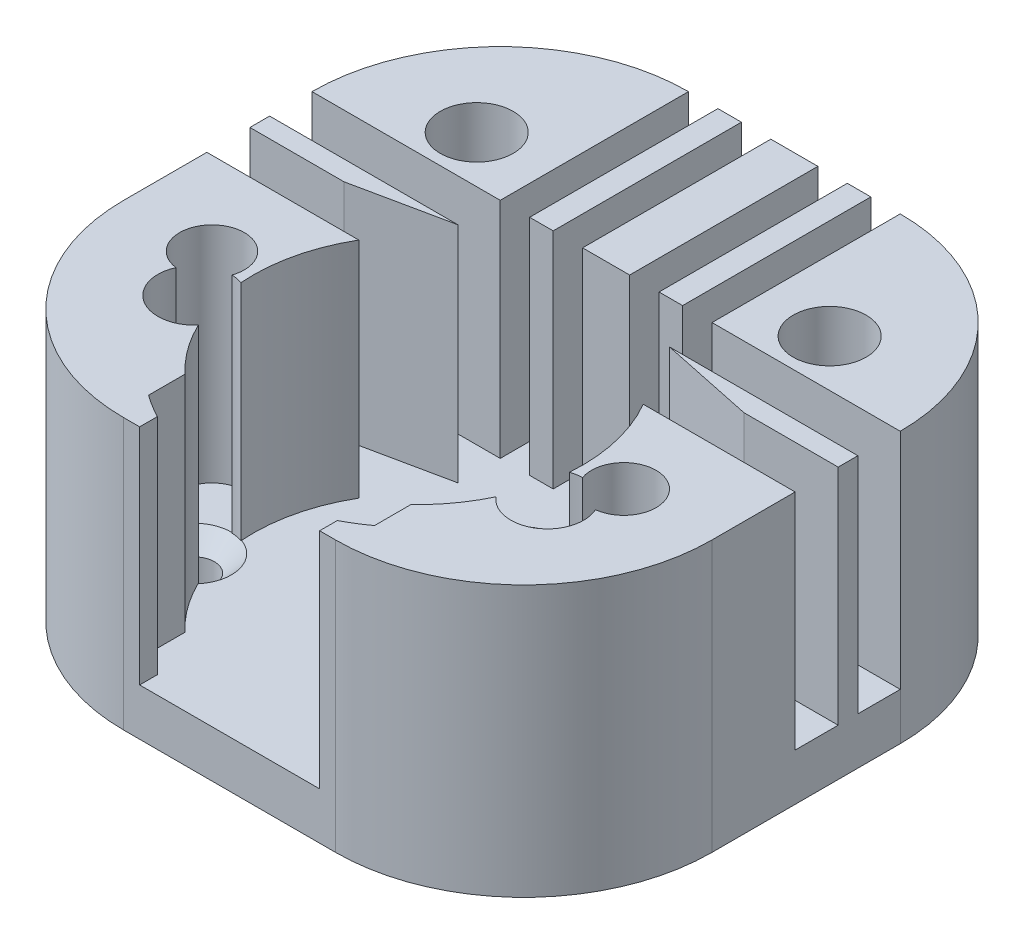
from build123d import *

# Parameters (mm, degrees)
SKETCH1_R                                    = 1.650000221024274
BOSS_EXTRUDE1_DEPTH                          = 4
BOSS_EXTRUDE2_OUTLINE_R                      = 2.75
BOSS_EXTRUDE2_OUTLINE_R_2                    = 1.650000221
BOSS_EXTRUDE2_OUTLINE_W                      = 2.000000000000001
BOSS_EXTRUDE2_OUTLINE_H                      = 16.000000209
BOSS_EXTRUDE2_OUTLINE_W_2                    = 4
BOSS_EXTRUDE2_DEPTH                          = 19
SKETCH6_R                                    = 3.1000000000000005
SKETCH6_R_2                                  = 3.0999999999999988
CUT_EXTRUDE2_DEPTH                           = 17
SKETCH7_R                                    = 3.1000000000000005
SKETCH7_R_2                                  = 3.0999999999999988
CUT_EXTRUDE3_DEPTH                           = 2
SKETCH11_R                                   = 5
CUT_EXTRUDE4_DEPTH                           = 10
CSK_FOR_M3_CROSS_RECESS_FLAT_HEAD_SC_2_COUNT = 2
CSK_FOR_M3_CROSS_RECESS_FLAT_HEAD_SC_2_PITCH = 29.999999886192118


# Read off the part's stored shape, not the designer's step: Boss-Extrude2
with BuildPart() as part:
    # Sketch1 → Boss-Extrude1 (new body)
    with BuildSketch(Plane(origin=(0, 0, 0), x_dir=(1, 0, 0), z_dir=(0, 1, 0))):
        with BuildLine():
            Line((-9.000000372528914, 24.000000208616257), (9.000000372528918, 24.000000208616257))
            ThreePointArc((9.000000372528918, 24.000000208616257), (20.31370887151379, 19.313708707601016), (25.00000037252903, 8.000000208616145))
            Line((25.00000037252903, 8.000000208616145), (25.00000037252903, -8.000000208616145))
            ThreePointArc((25.00000037252903, -8.000000208616145), (20.31370887151379, -19.313708707601016), (9.000000372528918, -24.000000208616257))
            Line((9.000000372528918, -24.000000208616257), (-9.000000372528914, -24.000000208616257))
            ThreePointArc((-9.000000372528914, -24.000000208616257), (-20.313708871513793, -19.31370870760102), (-25.00000037252903, -8.000000208616145))
            Line((-25.00000037252903, -8.000000208616145), (-25.00000037252903, 8.000000208616145))
            ThreePointArc((-25.00000037252903, 8.000000208616145), (-20.31370887151379, 19.313708707601016), (-9.000000372528914, 24.000000208616257))
        make_face()
        with Locations(Location((-14.999999943096059, 12.000001695688482, 0), (0, 0, 270))):
            Circle(SKETCH1_R, mode=Mode.SUBTRACT)
        with Locations(Location((14.999999943096059, 12.00000169568849, 0), (0, 0, 90))):
            Circle(SKETCH1_R, mode=Mode.SUBTRACT)
        with Locations(Location((14.999999943096059, -12.00000169568849, 0), (0, 0, 270))):
            Circle(SKETCH1_R, mode=Mode.SUBTRACT)
        with Locations(Location((-14.999999943096059, -12.000001695688482, 0), (0, 0, 90))):
            Circle(SKETCH1_R, mode=Mode.SUBTRACT)
    extrude(amount=BOSS_EXTRUDE1_DEPTH)

    # Boss-Extrude2 outline → Boss-Extrude2 (add)
    # profile 1 of 9: a face of its own
    with BuildSketch(Plane(origin=(0, 4, 0), x_dir=(1, 0, 0), z_dir=(0, 1, 0))):
        with BuildLine():
            ThreePointArc((-25.000000373, -8.000000209), (-20.313708872, -19.313708708), (-9.000000373, -24.000000209))
            Line((-9.000000373, -24.000000209), (-7.65, -24.000000209))
            Line((-7.65, -24.000000209), (-7.65, -22.5))
            ThreePointArc((-7.65, -22.5), (-8.646208076, -21.928947768), (-9.6, -21.289563574))
            Line((-9.6, -21.289563574), (-9.6, -18.190191362))
            ThreePointArc((-9.6, -18.190191362), (-11.86645746, -15.428807936), (-13.360259128, -12.183715576))
            ThreePointArc((-13.360259128, -12.183715576), (-16.594287762, -12.425145296), (-13.669460049, -11.024212621))
            ThreePointArc((-13.669460049, -11.024212621), (-13.83087583, -5.830466926), (-12.086943849, -0.935597096))
            Line((-12.086943849, -0.935597096), (-25.000000373, -0.935597096))
            Line((-25.000000373, -0.935597096), (-25.000000373, -8.000000209))
        make_face()
        with Locations((-17.5, -8)):
            Circle(BOSS_EXTRUDE2_OUTLINE_R, mode=Mode.SUBTRACT)
    # profile 2 of 9: a face of its own
    with BuildSketch(Plane(origin=(0, 4, 0), x_dir=(1, 0, 0), z_dir=(0, 1, 0))):
        with BuildLine():
            Line((7.65, -22.5), (7.65, -24.000000209))
            Line((7.65, -24.000000209), (9.000000373, -24.000000209))
            ThreePointArc((9.000000373, -24.000000209), (20.313708872, -19.313708708), (25.000000373, -8.000000209))
            Line((25.000000373, -8.000000209), (25.000000373, -0.935597096))
            Line((25.000000373, -0.935597096), (12.086943849, -0.935597096))
            ThreePointArc((12.086943849, -0.935597096), (13.83087583, -5.830466926), (13.669460049, -11.024212621))
            ThreePointArc((13.669460049, -11.024212621), (16.594287762, -12.425145296), (13.360259128, -12.183715576))
            ThreePointArc((13.360259128, -12.183715576), (11.86645746, -15.428807936), (9.6, -18.190191362))
            Line((9.6, -18.190191362), (9.6, -21.289563574))
            ThreePointArc((9.6, -21.289563574), (8.646208076, -21.928947768), (7.65, -22.5))
        make_face()
        with Locations((17.5, -8)):
            Circle(BOSS_EXTRUDE2_OUTLINE_R, mode=Mode.SUBTRACT)
    # profile 3 of 9: a face of its own
    with BuildSketch(Plane(origin=(0, 4, 0), x_dir=(1, 0, 0), z_dir=(0, 1, 0))):
        Polygon((-25.000000373, 4.399596768), (-25.000000373, 2.723805295), (-17, 2.723805295), (-9, 4.399596768), align=None)
    # profile 4 of 9: a face of its own
    with BuildSketch(Plane(origin=(0, 4, 0), x_dir=(1, 0, 0), z_dir=(0, 1, 0))):
        with BuildLine():
            ThreePointArc((-9.000000373, 24.000000209), (-20.313708872, 19.313708708), (-25.000000373, 8.000000209))
            Line((-25.000000373, 8.000000209), (-9, 8))
            Line((-9, 8), (-9.000000373, 24.000000209))
        make_face()
        with Locations((-14.999999943, 12.000001696)):
            Circle(BOSS_EXTRUDE2_OUTLINE_R_2, mode=Mode.SUBTRACT)
    # profile 5 of 9: a face of its own
    with BuildSketch(Plane(origin=(0, 4, 0), x_dir=(1, 0, 0), z_dir=(0, 1, 0))):
        Polygon((17, 2.723805295), (25.000000373, 2.723805295), (25.000000373, 4.399596768), (9, 4.399596768), align=None)
    # profile 6 of 9: a face of its own
    with BuildSketch(Plane(origin=(0, 4, 0), x_dir=(1, 0, 0), z_dir=(0, 1, 0))):
        with Locations((-5.5, 16.0000001045)):
            Rectangle(BOSS_EXTRUDE2_OUTLINE_W, BOSS_EXTRUDE2_OUTLINE_H)
    # profile 7 of 9: a face of its own
    with BuildSketch(Plane(origin=(0, 4, 0), x_dir=(1, 0, 0), z_dir=(0, 1, 0))):
        with BuildLine():
            Line((9, 8), (25.000000373, 8.000000209))
            ThreePointArc((25.000000373, 8.000000209), (20.313708872, 19.313708708), (9.000000373, 24.000000209))
            Line((9.000000373, 24.000000209), (9, 8))
        make_face()
        with Locations((14.999999943, 12.000001696)):
            Circle(BOSS_EXTRUDE2_OUTLINE_R_2, mode=Mode.SUBTRACT)
    # profile 8 of 9: a face of its own
    with BuildSketch(Plane(origin=(0, 4, 0), x_dir=(1, 0, 0), z_dir=(0, 1, 0))):
        with Locations((0, 16.0000001045)):
            Rectangle(BOSS_EXTRUDE2_OUTLINE_W_2, BOSS_EXTRUDE2_OUTLINE_H)
    # profile 9 of 9: a face of its own
    with BuildSketch(Plane(origin=(0, 4, 0), x_dir=(1, 0, 0), z_dir=(0, 1, 0))):
        with Locations((5.5, 16.0000001045)):
            Rectangle(BOSS_EXTRUDE2_OUTLINE_W, BOSS_EXTRUDE2_OUTLINE_H)
    extrude(amount=BOSS_EXTRUDE2_DEPTH)

    # Sketch6 → Cut-Extrude2 (cut)
    with BuildSketch(Plane(origin=(0, 23, 0), x_dir=(1, 0, 0), z_dir=(0, 1, 0))):
        with Locations((-14.999999943096059, -12.000001695688482)):
            Circle(SKETCH6_R)
        with Locations((14.999999943096062, -12.000001695688479)):
            Circle(SKETCH6_R_2)
        with Locations(Location((14.999999943096059, 12.000001695688482, 0), (0, 0, 270))):
            Circle(SKETCH6_R_2)
        with Locations(Location((-14.999999943096062, 12.000001695688479, 0), (0, 0, 90))):
            Circle(SKETCH6_R)
    extrude(amount=-CUT_EXTRUDE2_DEPTH, mode=Mode.SUBTRACT)

    # Sketch7 → Cut-Extrude3 (cut)
    with BuildSketch(Plane(origin=(0, 5.999999999999998, 0), x_dir=(1, 0, 0), z_dir=(0, 1, 0))):
        with Locations((-14.999999943096059, -12.000001695688482)):
            Circle(SKETCH7_R)
        with Locations((14.999999943096062, -12.000001695688479)):
            Circle(SKETCH7_R_2)
    extrude(amount=-CUT_EXTRUDE3_DEPTH, mode=Mode.SUBTRACT)

    # Sketch11 → Cut-Extrude4 (cut)
    with BuildSketch(Plane.XZ):
        with Locations(Location((0, 0, 0), (0, 0, 270))):
            Circle(SKETCH11_R)
    extrude(amount=-CUT_EXTRUDE4_DEPTH, mode=Mode.SUBTRACT)

    # Sketch10 → CSK for M3 Cross Recess Flat Head Screw1 (revolve, cut)
    with BuildSketch(Plane(origin=(-14.999999943096059, 4, 12.000001695688482), x_dir=(0, 0, 1), z_dir=(1, 0, 0))):
        Polygon((0, 0), (-7.6e-15, 31.021463052346846), (1.6999999999999862, 30), (1.699999999999996, 1.45), (3.15, -1.73e-15), align=None)
    csk_for_m3_cross_recess_flat_head_screw1 = revolve(axis=Axis((-14.999999943096059, 10.34999999999999, 12.000001695688482), (0, -1, 0)), mode=Mode.SUBTRACT)

    # CSK for M3 Cross Recess Flat Head Sc 2: CSK for M3 Cross Recess Flat Head Screw1 ×2
    with Locations(*[(i * CSK_FOR_M3_CROSS_RECESS_FLAT_HEAD_SC_2_PITCH, 0, 0) for i in range(1, CSK_FOR_M3_CROSS_RECESS_FLAT_HEAD_SC_2_COUNT)]):
        add(csk_for_m3_cross_recess_flat_head_screw1, mode=Mode.SUBTRACT)


solid = part.part
